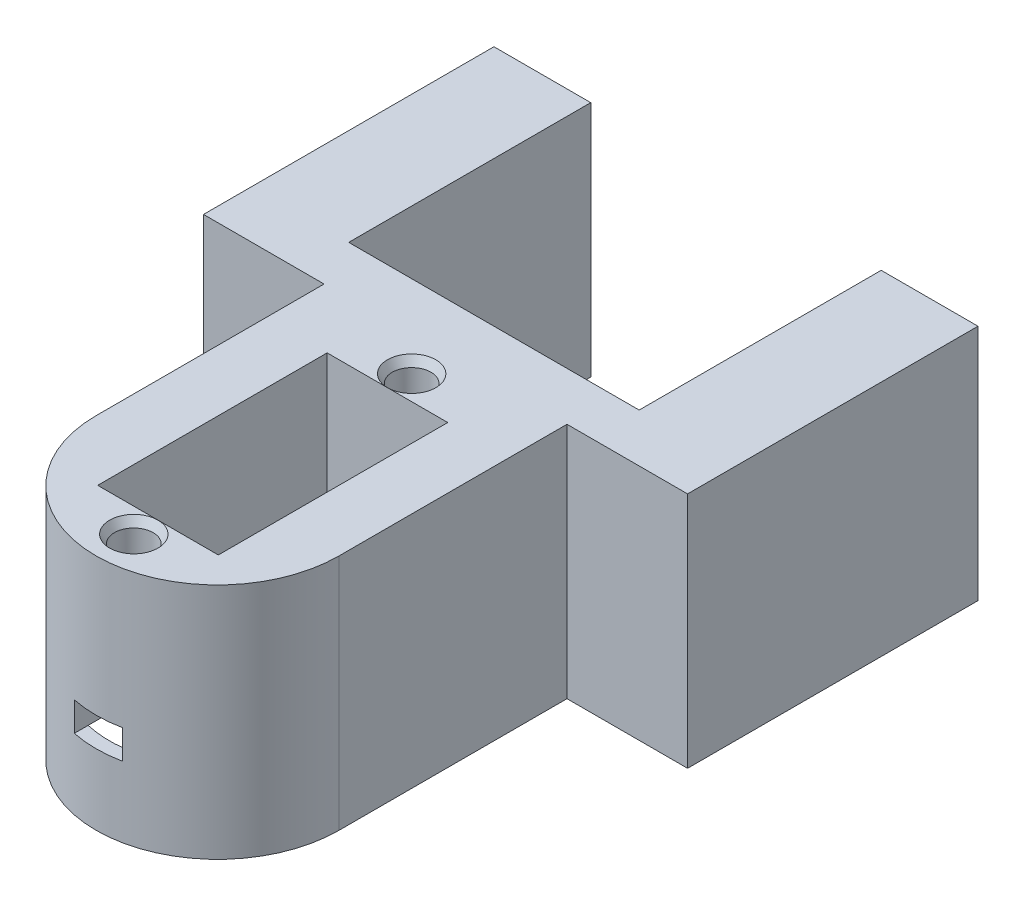
from build123d import *
from OCP.BRepFilletAPI import BRepFilletAPI_MakeChamfer

# Parameters (mm, degrees)
SKETCH4_W                = 12.46
SKETCH4_H                = 17.25
BOSS_EXTRUDE3_DEPTH      = 6
BOSS_EXTRUDE6_DEPTH      = 7.3
BOSS_EXTRUDE6_DEPTH_BACK = 17.25
SKETCH8_R                = 12.546781182
SKETCH8_R_2              = 11.15
BOSS_EXTRUDE4_DEPTH      = 17.25
SKETCH6_R                = 2
CUT_EXTRUDE1_DEPTH       = 5
CHAMFER1_SIZE            = 0.5
CHAMFER1_SIZE_2          = 0.866025404
SKETCH10_W               = 12.46
SKETCH10_H               = 23.7
CUT_EXTRUDE3_DEPTH       = 17.25
CUT_EXTRUDE4_REACH       = 83.955
SKETCH11_W               = 5
SKETCH11_H               = 3
BOSS_EXTRUDE7_START      = -7.3
BOSS_EXTRUDE7_DEPTH      = 7.3
BOSS_EXTRUDE8_DEPTH      = 24.55


with BuildPart() as part:
    # Sketch4 → Boss-Extrude3 (new body)
    with BuildSketch(Plane.XY):
        with Locations((0, 63.875025481)):
            Rectangle(SKETCH4_W, SKETCH4_H)
    extrude(amount=BOSS_EXTRUDE3_DEPTH)



with BuildPart() as body_2:
    # Sketch8 → Boss-Extrude6 (new, two sides: drawn at the far end of the back side and taken through both)
    with BuildSketch(Plane(origin=(0, 55.250025481, 0), x_dir=(-1, 0, 0), z_dir=(0, -1, 0)).offset(-BOSS_EXTRUDE6_DEPTH_BACK)):
        with Locations(Location((0, -23.55, 0), (0, 0, 90))):
            Circle(SKETCH8_R)
        with Locations(Location((0, -23.55, 0), (0, 0, 90))):
            Circle(SKETCH8_R_2, mode=Mode.SUBTRACT)
    extrude(amount=BOSS_EXTRUDE6_DEPTH + BOSS_EXTRUDE6_DEPTH_BACK)


with BuildPart() as part_1:
    add(part.part)

    add(body_2.part)  # Boss-Extrude4 merges body 2
    # Sketch5 → Boss-Extrude4 (add)
    with BuildSketch(Plane(origin=(0, 72.500025481, 0), x_dir=(1, 0, 0), z_dir=(0, 1, 0))):
        with BuildLine():
            Line((12.546781182, -23.55), (12.546781182, 0))
            Line((12.546781182, 0), (6.23, 0))
            Line((6.23, 0), (6.23, -29.7))
            Line((6.23, -29.7), (-6.23, -29.7))
            Line((-6.23, -29.7), (-6.23, 0))
            Line((-6.23, 0), (-12.546781182, 0))
            Line((-12.546781182, 0), (-12.546781182, -23.55))
            ThreePointArc((-12.546781182, -23.55), (0, -36.096781182), (12.546781182, -23.55))
        make_face()
    extrude(amount=-BOSS_EXTRUDE4_DEPTH)

    # Sketch6 → Cut-Extrude1 (cut)
    with BuildSketch(Plane(origin=(0, 72.500025481, 0), x_dir=(1, 0, 0), z_dir=(0, 1, 0))):
        with Locations(Location((0, -3.5, 0), (0, 0, 270))):
            Circle(SKETCH6_R)
        with Locations(Location((0, -32.2, 0), (0, 0, 270))):
            Circle(SKETCH6_R)
    extrude(amount=-CUT_EXTRUDE1_DEPTH, mode=Mode.SUBTRACT)

    # Chamfer1
    chamfer1_edges_1 = [part_1.edges().sort_by_distance(p)[0] for p in [
        (0, 72.500025481, 1.5),
    ]]
    chamfer1_side_1 = [part_1.faces().sort_by_distance(p)[0] for p in [
        (0, 72.500025481, 1.49),
    ]]
    chamfer1_edges_2 = [part_1.edges().sort_by_distance(p)[0] for p in [
        (0, 72.500025481, 30.2),
    ]]
    chamfer1_side_2 = [part_1.faces().sort_by_distance(p)[0] for p in [
        (0, 72.500025481, 30.19),
    ]]
    chamfer1 = BRepFilletAPI_MakeChamfer(part_1.part.solid().wrapped)
    for e in chamfer1_edges_1:
        chamfer1.Add(CHAMFER1_SIZE - 0.0001, CHAMFER1_SIZE_2 - 0.0001, e.wrapped, chamfer1_side_1[0].wrapped)
    for e in chamfer1_edges_2:
        chamfer1.Add(CHAMFER1_SIZE - 0.0001, CHAMFER1_SIZE_2 - 0.0001, e.wrapped, chamfer1_side_2[0].wrapped)
    add(Compound.cast(chamfer1.Shape()), mode=Mode.REPLACE)  # a hair under: the kernel refuses the full size

    # Sketch10 → Cut-Extrude3 (cut)
    with BuildSketch(Plane(origin=(0, 72.500025481, 0), x_dir=(1, 0, 0), z_dir=(0, 1, 0))):
        with Locations((0, -17.85)):
            Rectangle(SKETCH10_W, SKETCH10_H)
    extrude(amount=-CUT_EXTRUDE3_DEPTH, mode=Mode.SUBTRACT)

    # Sketch11 → Cut-Extrude4 (cut, up to next)
    with BuildSketch(Plane.XY.offset(36.096781182), mode=Mode.PRIVATE) as cut_extrude4_sk1:
        with Locations((0, 56.750025481)):
            Rectangle(SKETCH11_W, SKETCH11_H)
    cut_extrude4_tool1 = extrude(cut_extrude4_sk1.sketch, amount=-CUT_EXTRUDE4_REACH, mode=Mode.PRIVATE) & part_1.part
    add(cut_extrude4_tool1.solids().sort_by_distance((0, 56.750025, 36.096781))[0], mode=Mode.SUBTRACT)

    # Sketch13 → Boss-Extrude7 (add)
    with BuildSketch(Plane.XZ.offset(-47.950025481).offset(BOSS_EXTRUDE7_START)):
        with BuildLine():
            Line((-12.546781182, 23.55), (-12.546781182, 0))
            Line((-12.546781182, 0), (12.546781182, 0))
            Line((12.546781182, 0), (12.546781182, 23.55))
            ThreePointArc((12.546781182, 23.55), (0, 11.003218818), (-12.546781182, 23.55))
        make_face()
    extrude(amount=BOSS_EXTRUDE7_DEPTH)

    # Sketch14 → Boss-Extrude8 (add)
    with BuildSketch(Plane(origin=(0, 72.500025481, 0), x_dir=(1, 0, 0), z_dir=(0, 1, 0))):
        Polygon((-25, 0), (-25, 30), (-15, 30), (-15, 5), (15, 5), (15, 30), (25, 30), (25, 0), align=None)
    extrude(amount=-BOSS_EXTRUDE8_DEPTH)


solid = part_1.part
